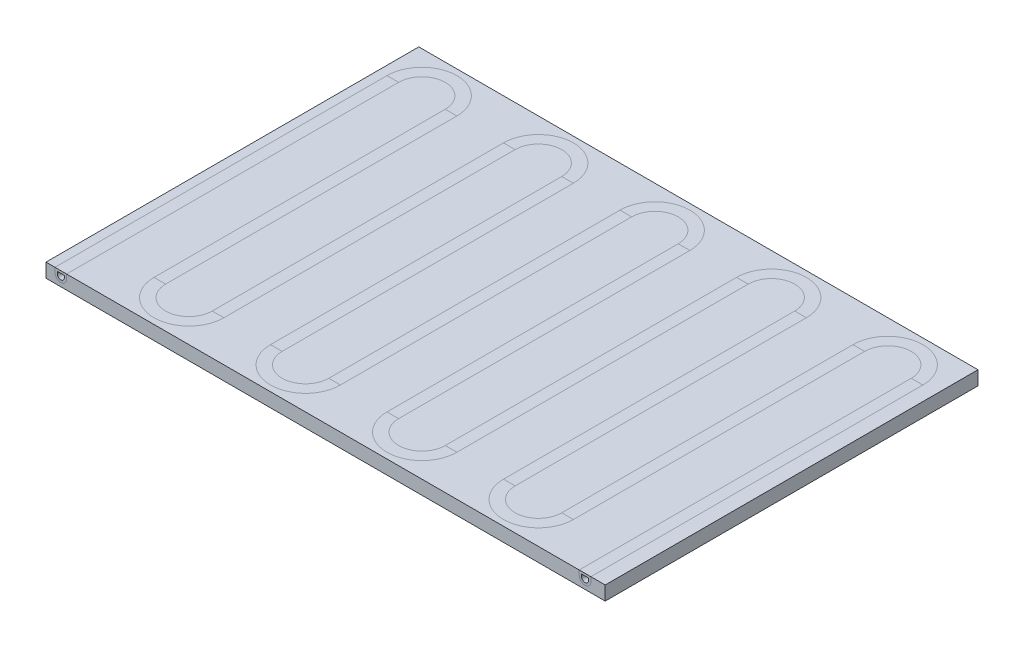
from build123d import *

# Parameters (mm, degrees)
SKETCH1_W        = 240
SKETCH1_H        = 160
BASE_PLATE_DEPTH = 6


with BuildPart() as part:
    # Sketch1 → Base Plate (new body)
    with BuildSketch(Plane(origin=(0, 0, 0), x_dir=(1, 0, 0), z_dir=(0, 1, 0))):
        Rectangle(SKETCH1_W, SKETCH1_H)
    extrude(amount=BASE_PLATE_DEPTH)

    # Tube Channel: sweep along a path in Sketch5
    with BuildLine(Plane(origin=(0, 6, 0), x_dir=(1, 0, 0), z_dir=(0, 1, 0))) as tube_channel_path:
        Line((-113.65, -80), (-113.65, 62.500000235))
        ThreePointArc((-113.65, 62.500000235), (-101.150000235, 75), (-88.65000047, 62.500000235))
        Line((-88.65000047, 62.500000235), (-88.65000047, -62.500000235))
        ThreePointArc((-88.65000047, -62.500000235), (-76.150000705, -75), (-63.65000094, -62.500000235))
        Line((-63.65000094, -62.500000235), (-63.65000094, 62.500000235))
        ThreePointArc((-63.65000094, 62.500000235), (-51.150001175, 75), (-38.65000141, 62.500000235))
        Line((-38.65000141, 62.500000235), (-38.65000141, -62.500000235))
        ThreePointArc((-38.65000141, -62.500000235), (-26.150001645, -75), (-13.65000188, -62.500000235))
        Line((-13.65000188, -62.500000235), (-13.65000188, 62.500000235))
        ThreePointArc((-13.65000188, 62.500000235), (-1.150002115, 75), (11.34999765, 62.500000235))
        Line((11.34999765, 62.500000235), (11.34999765, -62.500000235))
        ThreePointArc((11.34999765, -62.500000235), (23.849997415, -75), (36.34999718, -62.500000235))
        Line((36.34999718, -62.500000235), (36.34999718, 62.500000235))
        ThreePointArc((36.34999718, 62.500000235), (48.849996945, 75), (61.34999671, 62.500000235))
        Line((61.34999671, 62.500000235), (61.34999671, -62.500000235))
        ThreePointArc((61.34999671, -62.500000235), (73.849996475, -75), (86.34999624, -62.500000235))
        Line((86.34999624, -62.500000235), (86.34999624, 62.500000235))
        ThreePointArc((86.34999624, 62.500000235), (98.849996005, 75), (111.34999577, 62.500000235))
        Line((111.34999577, 62.500000235), (111.34999577, -80))
    # Sketch6 → Tube Channel (sweep, cut)
    with BuildSketch(Plane.XY.offset(80)):
        with BuildLine():
            Line((-116.149999953, 4.095), (-116.149999953, 6))
            Line((-116.149999953, 6), (-111.150000047, 6))
            Line((-111.150000047, 6), (-111.150000047, 4.095))
            ThreePointArc((-111.150000047, 4.095), (-113.65, 1.595000047), (-116.149999953, 4.095))
        make_face()
    sweep(path=tube_channel_path.line, mode=Mode.SUBTRACT)


with BuildPart() as body_2:
    # Tubing: sweep along a path in Sketch5<3>
    with BuildLine(Plane(origin=(0, 6, 0), x_dir=(1, 0, 0), z_dir=(0, 1, 0))) as tubing_path:
        Line((-113.65, -80), (-113.65, 62.500000235))
        ThreePointArc((-113.65, 62.500000235), (-101.150000235, 75), (-88.65000047, 62.500000235))
        Line((-88.65000047, 62.500000235), (-88.65000047, -62.500000235))
        ThreePointArc((-88.65000047, -62.500000235), (-76.150000705, -75), (-63.65000094, -62.500000235))
        Line((-63.65000094, -62.500000235), (-63.65000094, 62.500000235))
        ThreePointArc((-63.65000094, 62.500000235), (-51.150001175, 75), (-38.65000141, 62.500000235))
        Line((-38.65000141, 62.500000235), (-38.65000141, -62.500000235))
        ThreePointArc((-38.65000141, -62.500000235), (-26.150001645, -75), (-13.65000188, -62.500000235))
        Line((-13.65000188, -62.500000235), (-13.65000188, 62.500000235))
        ThreePointArc((-13.65000188, 62.500000235), (-1.150002115, 75), (11.34999765, 62.500000235))
        Line((11.34999765, 62.500000235), (11.34999765, -62.500000235))
        ThreePointArc((11.34999765, -62.500000235), (23.849997415, -75), (36.34999718, -62.500000235))
        Line((36.34999718, -62.500000235), (36.34999718, 62.500000235))
        ThreePointArc((36.34999718, 62.500000235), (48.849996945, 75), (61.34999671, 62.500000235))
        Line((61.34999671, 62.500000235), (61.34999671, -62.500000235))
        ThreePointArc((61.34999671, -62.500000235), (73.849996475, -75), (86.34999624, -62.500000235))
        Line((86.34999624, -62.500000235), (86.34999624, 62.500000235))
        ThreePointArc((86.34999624, 62.500000235), (98.849996005, 75), (111.34999577, 62.500000235))
        Line((111.34999577, 62.500000235), (111.34999577, -80))
    # Sketch7 → Tubing (sweep)
    with BuildSketch(Plane.XY.offset(80)):
        with BuildLine():
            Line((-116.149999953, 4.095), (-116.149999953, 6))
            Line((-116.149999953, 6), (-111.150000047, 6))
            Line((-111.150000047, 6), (-111.150000047, 4.095))
            ThreePointArc((-111.150000047, 4.095), (-113.65, 1.595000047), (-116.149999953, 4.095))
        make_face()
        with BuildLine():
            Line((-115.149999921, 4.095), (-115.149999921, 4.999999968))
            Line((-115.149999921, 4.999999968), (-112.150000079, 4.999999968))
            Line((-112.150000079, 4.999999968), (-112.150000079, 4.095))
            ThreePointArc((-112.150000079, 4.095), (-113.65, 2.595000079), (-115.149999921, 4.095))
        make_face(mode=Mode.SUBTRACT)
    sweep(path=tubing_path.line)


solid = Compound([part.part, body_2.part])
